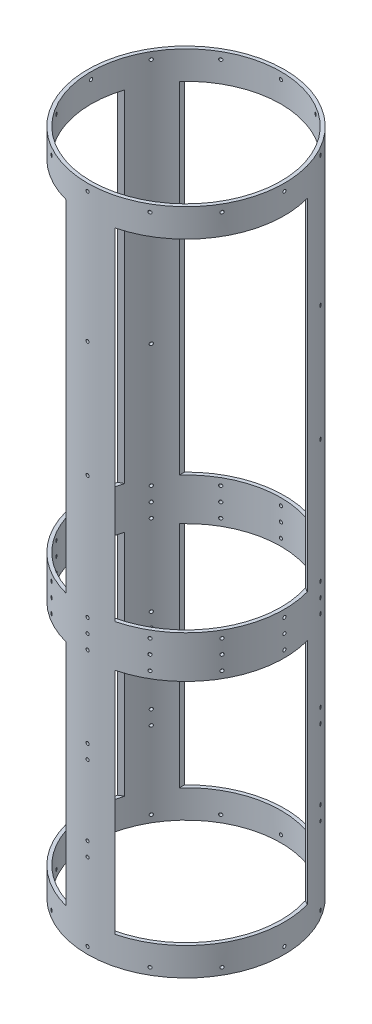
from build123d import *

# Parameters (mm, degrees)
SKETCH1_R                = 88.9
SKETCH1_R_2              = 85.725
BOSS_EXTRUDE1_DEPTH      = 301.625
CUT_EXTRUDE1_REACH       = 328.778
CUT_EXTRUDE1_END_RADIUS  = 88.9
SKETCH2_W                = 127
SKETCH2_H                = 206.502
SKETCH2_H_2              = 307.848
CIRPATTERN1_COUNT        = 3
SKETCH3_R                = 1.4351
CUT_EXTRUDE2_DEPTH       = 25.908
CIRPATTERN2_COUNT        = 12
MIRROR1_COPY_1_SKETCH_R  = 1.4351
MIRROR1_COPY_1_DEPTH     = 25.908
MIRROR1_COPY_2_SKETCH_R  = 1.4351
MIRROR1_COPY_2_DEPTH     = 25.908
MIRROR1_COPY_3_SKETCH_R  = 1.4351
MIRROR1_COPY_3_DEPTH     = 25.908
MIRROR1_COPY_4_SKETCH_R  = 1.4351
MIRROR1_COPY_4_DEPTH     = 25.908
MIRROR1_COPY_5_SKETCH_R  = 1.4351
MIRROR1_COPY_5_DEPTH     = 25.908
MIRROR1_COPY_6_SKETCH_R  = 1.4351
MIRROR1_COPY_6_DEPTH     = 25.908
MIRROR1_COPY_7_SKETCH_R  = 1.4351
MIRROR1_COPY_7_DEPTH     = 25.908
MIRROR1_COPY_8_SKETCH_R  = 1.4351
MIRROR1_COPY_8_DEPTH     = 25.908
MIRROR1_COPY_9_SKETCH_R  = 1.4351
MIRROR1_COPY_9_DEPTH     = 25.908
MIRROR1_COPY_10_SKETCH_R = 1.4351
MIRROR1_COPY_10_DEPTH    = 25.908
MIRROR1_COPY_11_SKETCH_R = 1.4351
MIRROR1_COPY_11_DEPTH    = 25.908
MIRROR1_COPY_12_SKETCH_R = 1.4351
MIRROR1_COPY_12_DEPTH    = 25.908
SKETCH4_R                = 1.4351
CUT_EXTRUDE3_DEPTH       = 34.798
CIRPATTERN3_COUNT        = 3
SKETCH5_R                = 1.4351
CUT_EXTRUDE4_DEPTH       = 87.63
CIRPATTERN4_COUNT        = 12


with BuildPart() as part:
    # Sketch1 → Boss-Extrude1 (new, symmetric)
    with BuildSketch(Plane(origin=(0, 0, 0), x_dir=(1, 0, 0), z_dir=(0, 1, 0))):
        Circle(SKETCH1_R)
        Circle(SKETCH1_R_2, mode=Mode.SUBTRACT)
    extrude(amount=BOSS_EXTRUDE1_DEPTH, both=True)

    # Cut-Extrude1: up to this cylinder (the profile starts inside it)
    cut_extrude1_end = Plane(origin=(0, -25.3365, 0), z_dir=(0, -1, 0)) * Cylinder(CUT_EXTRUDE1_END_RADIUS, 1131.631, mode=Mode.PRIVATE)
    # Sketch2 → Cut-Extrude1 (cut, up to the surface)
    with BuildSketch(Plane.XY, mode=Mode.PRIVATE) as cut_extrude1_sk1:
        with Locations((0, -172.974)):
            Rectangle(SKETCH2_W, SKETCH2_H)
    cut_extrude1_tool1 = extrude(cut_extrude1_sk1.sketch, amount=-CUT_EXTRUDE1_REACH, mode=Mode.PRIVATE) & cut_extrude1_end
    # Sketch2 → Cut-Extrude1 (cut, up to the surface)
    with BuildSketch(Plane.XY, mode=Mode.PRIVATE) as cut_extrude1_sk2:
        with Locations((0, 122.301)):
            Rectangle(SKETCH2_W, SKETCH2_H_2)
    cut_extrude1_tool2 = extrude(cut_extrude1_sk2.sketch, amount=-CUT_EXTRUDE1_REACH, mode=Mode.PRIVATE) & cut_extrude1_end
    cut_extrude1 = cut_extrude1_tool1.solids().sort_by_distance((0, -172.974, 0))[0] + cut_extrude1_tool2.solids().sort_by_distance((0, 122.301, 0))[0]
    add(cut_extrude1, mode=Mode.SUBTRACT)

    # CirPattern1: Cut-Extrude1 ×3 about axis
    cirpattern1_axis = Axis((0, 301.625, 0), (0, -1, 0))
    for i in range(1, CIRPATTERN1_COUNT):
        add(cut_extrude1.rotate(cirpattern1_axis, i * 360 / CIRPATTERN1_COUNT), mode=Mode.SUBTRACT)

    # Sketch3 → Cut-Extrude2 (cut)
    with BuildSketch(Plane.XY.offset(88.9)):
        with Locations((0, 295.275)):
            Circle(SKETCH3_R)
    cut_extrude2 = extrude(amount=-CUT_EXTRUDE2_DEPTH, mode=Mode.SUBTRACT)

    # CirPattern2: Cut-Extrude2 ×12 about axis
    cirpattern2_axis = Axis((0, 301.625, 0), (0, -1, 0))
    for i in range(1, CIRPATTERN2_COUNT):
        add(cut_extrude2.rotate(cirpattern2_axis, i * 360 / CIRPATTERN2_COUNT), mode=Mode.SUBTRACT)

    # Mirror1 copy 1 sketch → Mirror1 copy 1 (cut)
    with BuildSketch(Plane(origin=(-44.45, 0, 76.989658396), x_dir=(0.8660254037844387, 0, 0.49999999999999994), z_dir=(-0.49999999999999994, 0, 0.8660254037844387))):
        with Locations((0, -295.275)):
            Circle(MIRROR1_COPY_1_SKETCH_R)
    extrude(amount=-MIRROR1_COPY_1_DEPTH, mode=Mode.SUBTRACT)

    # Mirror1 copy 2 sketch → Mirror1 copy 2 (cut)
    with BuildSketch(Plane(origin=(-76.989658396, 0, 44.45), x_dir=(0.5000000000000001, 0, 0.8660254037844386), z_dir=(-0.8660254037844386, 0, 0.5000000000000001))):
        with Locations((0, -295.275)):
            Circle(MIRROR1_COPY_2_SKETCH_R)
    extrude(amount=-MIRROR1_COPY_2_DEPTH, mode=Mode.SUBTRACT)

    # Mirror1 copy 3 sketch → Mirror1 copy 3 (cut)
    with BuildSketch(Plane.ZY.offset(88.9)):
        with Locations((0, -295.275)):
            Circle(MIRROR1_COPY_3_SKETCH_R)
    extrude(amount=-MIRROR1_COPY_3_DEPTH, mode=Mode.SUBTRACT)

    # Mirror1 copy 4 sketch → Mirror1 copy 4 (cut)
    with BuildSketch(Plane(origin=(-76.989658396, 0, -44.45), x_dir=(-0.4999999999999998, 0, 0.8660254037844387), z_dir=(-0.8660254037844387, 0, -0.4999999999999998))):
        with Locations((0, -295.275)):
            Circle(MIRROR1_COPY_4_SKETCH_R)
    extrude(amount=-MIRROR1_COPY_4_DEPTH, mode=Mode.SUBTRACT)

    # Mirror1 copy 5 sketch → Mirror1 copy 5 (cut)
    with BuildSketch(Plane(origin=(-44.45, 0, -76.989658396), x_dir=(-0.8660254037844387, 0, 0.49999999999999994), z_dir=(-0.49999999999999994, 0, -0.8660254037844387))):
        with Locations((0, -295.275)):
            Circle(MIRROR1_COPY_5_SKETCH_R)
    extrude(amount=-MIRROR1_COPY_5_DEPTH, mode=Mode.SUBTRACT)

    # Mirror1 copy 6 sketch → Mirror1 copy 6 (cut)
    with BuildSketch(Plane(origin=(0, 0, -88.9), x_dir=(-1, 0, 0), z_dir=(0, 0, -1))):
        with Locations((0, -295.275)):
            Circle(MIRROR1_COPY_6_SKETCH_R)
    extrude(amount=-MIRROR1_COPY_6_DEPTH, mode=Mode.SUBTRACT)

    # Mirror1 copy 7 sketch → Mirror1 copy 7 (cut)
    with BuildSketch(Plane(origin=(44.45, 0, -76.989658396), x_dir=(-0.8660254037844386, 0, -0.5000000000000001), z_dir=(0.5000000000000001, 0, -0.8660254037844386))):
        with Locations((0, -295.275)):
            Circle(MIRROR1_COPY_7_SKETCH_R)
    extrude(amount=-MIRROR1_COPY_7_DEPTH, mode=Mode.SUBTRACT)

    # Mirror1 copy 8 sketch → Mirror1 copy 8 (cut)
    with BuildSketch(Plane(origin=(76.989658396, 0, -44.45), x_dir=(-0.5000000000000004, 0, -0.8660254037844384), z_dir=(0.8660254037844384, 0, -0.5000000000000004))):
        with Locations((0, -295.275)):
            Circle(MIRROR1_COPY_8_SKETCH_R)
    extrude(amount=-MIRROR1_COPY_8_DEPTH, mode=Mode.SUBTRACT)

    # Mirror1 copy 9 sketch → Mirror1 copy 9 (cut)
    with BuildSketch(Plane(origin=(88.9, 0, 0), x_dir=(0, 0, -1), z_dir=(1, 0, 0))):
        with Locations((0, -295.275)):
            Circle(MIRROR1_COPY_9_SKETCH_R)
    extrude(amount=-MIRROR1_COPY_9_DEPTH, mode=Mode.SUBTRACT)

    # Mirror1 copy 10 sketch → Mirror1 copy 10 (cut)
    with BuildSketch(Plane(origin=(76.989658396, 0, 44.45), x_dir=(0.5000000000000001, 0, -0.8660254037844386), z_dir=(0.8660254037844386, 0, 0.5000000000000001))):
        with Locations((0, -295.275)):
            Circle(MIRROR1_COPY_10_SKETCH_R)
    extrude(amount=-MIRROR1_COPY_10_DEPTH, mode=Mode.SUBTRACT)

    # Mirror1 copy 11 sketch → Mirror1 copy 11 (cut)
    with BuildSketch(Plane(origin=(44.45, 0, 76.989658396), x_dir=(0.8660254037844384, 0, -0.5000000000000004), z_dir=(0.5000000000000004, 0, 0.8660254037844384))):
        with Locations((0, -295.275)):
            Circle(MIRROR1_COPY_11_SKETCH_R)
    extrude(amount=-MIRROR1_COPY_11_DEPTH, mode=Mode.SUBTRACT)

    # Mirror1 copy 12 sketch → Mirror1 copy 12 (cut)
    with BuildSketch(Plane.XY.offset(88.9)):
        with Locations((0, -295.275)):
            Circle(MIRROR1_COPY_12_SKETCH_R)
    extrude(amount=-MIRROR1_COPY_12_DEPTH, mode=Mode.SUBTRACT)

    # Sketch4 → Cut-Extrude3 (cut)
    with BuildSketch(Plane.XY.offset(88.9)):
        with Locations((0, -225.425)):
            Circle(SKETCH4_R)
        with Locations((0, -212.725)):
            Circle(SKETCH4_R)
        with Locations((0, -149.225)):
            Circle(SKETCH4_R)
        with Locations((0, -136.525)):
            Circle(SKETCH4_R)
    cut_extrude3 = extrude(amount=-CUT_EXTRUDE3_DEPTH, mode=Mode.SUBTRACT)

    # CirPattern3: Cut-Extrude3 ×3 about axis
    cirpattern3_axis = Axis((0, 301.625, 0), (0, -1, 0))
    for i in range(1, CIRPATTERN3_COUNT):
        add(cut_extrude3.rotate(cirpattern3_axis, i * 360 / CIRPATTERN3_COUNT), mode=Mode.SUBTRACT)

    # Sketch5 → Cut-Extrude4 (cut)
    with BuildSketch(Plane.XY.offset(88.9)):
        with Locations((0, -50.673)):
            Circle(SKETCH5_R)
        with Locations((0, 73.025)):
            Circle(SKETCH5_R)
        with Locations((0, 177.927)):
            Circle(SKETCH5_R)
        with Locations((0, -37.973)):
            Circle(SKETCH5_R)
        with Locations((0, -63.373)):
            Circle(SKETCH5_R)
    cut_extrude4 = extrude(amount=-CUT_EXTRUDE4_DEPTH, mode=Mode.SUBTRACT)

    # CirPattern4: Cut-Extrude4 ×12 about axis
    cirpattern4_axis = Axis((0, 301.625, 0), (0, -1, 0))
    for i in range(1, CIRPATTERN4_COUNT):
        add(cut_extrude4.rotate(cirpattern4_axis, i * 360 / CIRPATTERN4_COUNT), mode=Mode.SUBTRACT)


solid = part.part
